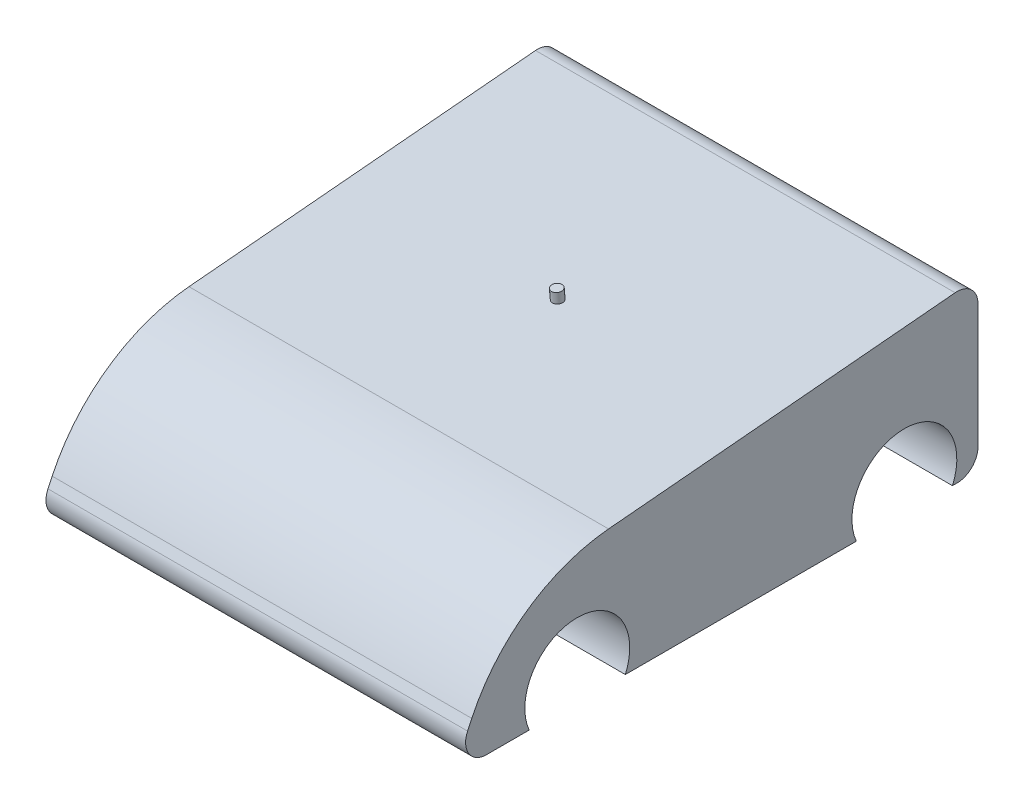
from build123d import *

# Parameters (mm, degrees)
BOSS_EXTRUDE1_DEPTH = 100
SKETCH3_R           = 25
CUT_EXTRUDE1_DEPTH  = 50
SKETCH4_R           = 2.5
BOSS_EXTRUDE2_DEPTH = 5


with BuildPart() as part:
    # Sketch2 → Boss-Extrude1 (new, symmetric)
    with BuildSketch(Plane(origin=(0, 0, 0), x_dir=(0, 0, -1), z_dir=(1, 0, 0))):
        with BuildLine():
            Line((-112.643906845, 14.257821235), (-110.645286598, 18.505070953))
            ThreePointArc((-110.645286598, 18.505070953), (-84.118524888, 49.993435328), (-45.444881226, 64.119137564))
            Line((-45.444881226, 64.119137564), (119.748610721, 79.017143226))
            ThreePointArc((119.748610721, 79.017143226), (127.392850703, 76.439367824), (130.646817248, 69.057563665))
            Line((130.646817248, 69.057563665), (130.646817248, 10))
            ThreePointArc((130.646817248, 10), (127.71788506, 2.928932188), (120.646817248, 0))
            Line((120.646817248, 0), (-103.595649647, 0))
            ThreePointArc((-103.595649647, 0), (-112.038937287, 4.641745263), (-112.643906845, 14.257821235))
        make_face()
    extrude(amount=BOSS_EXTRUDE1_DEPTH, both=True)

    # Sketch3 → Cut-Extrude1 (cut)
    with BuildSketch(Plane(origin=(100, 0, 0), x_dir=(0, 0, -1), z_dir=(1, 0, 0))):
        with Locations((-60.35749377, 10)):
            Circle(SKETCH3_R)
        with Locations((95.561704497, 10)):
            Circle(SKETCH3_R)
    cut_extrude1 = extrude(amount=-CUT_EXTRUDE1_DEPTH, mode=Mode.SUBTRACT)

    # Mirror1: Cut-Extrude1 across plane
    add(cut_extrude1.mirror(Plane(origin=(0, 0, 0), x_dir=(0, 0, 1), z_dir=(1, 0, 0))), mode=Mode.SUBTRACT)

    # Sketch4 → Boss-Extrude2 (add)
    with BuildSketch(Plane(origin=(0, 67.667230134, 6.102581681), x_dir=(1, 0, 0), z_dir=(0, 0.9959579561140941, 0.0898206527088083))):
        with Locations((0, 36.574402855)):
            Circle(SKETCH4_R)
    extrude(amount=BOSS_EXTRUDE2_DEPTH)


solid = part.part
